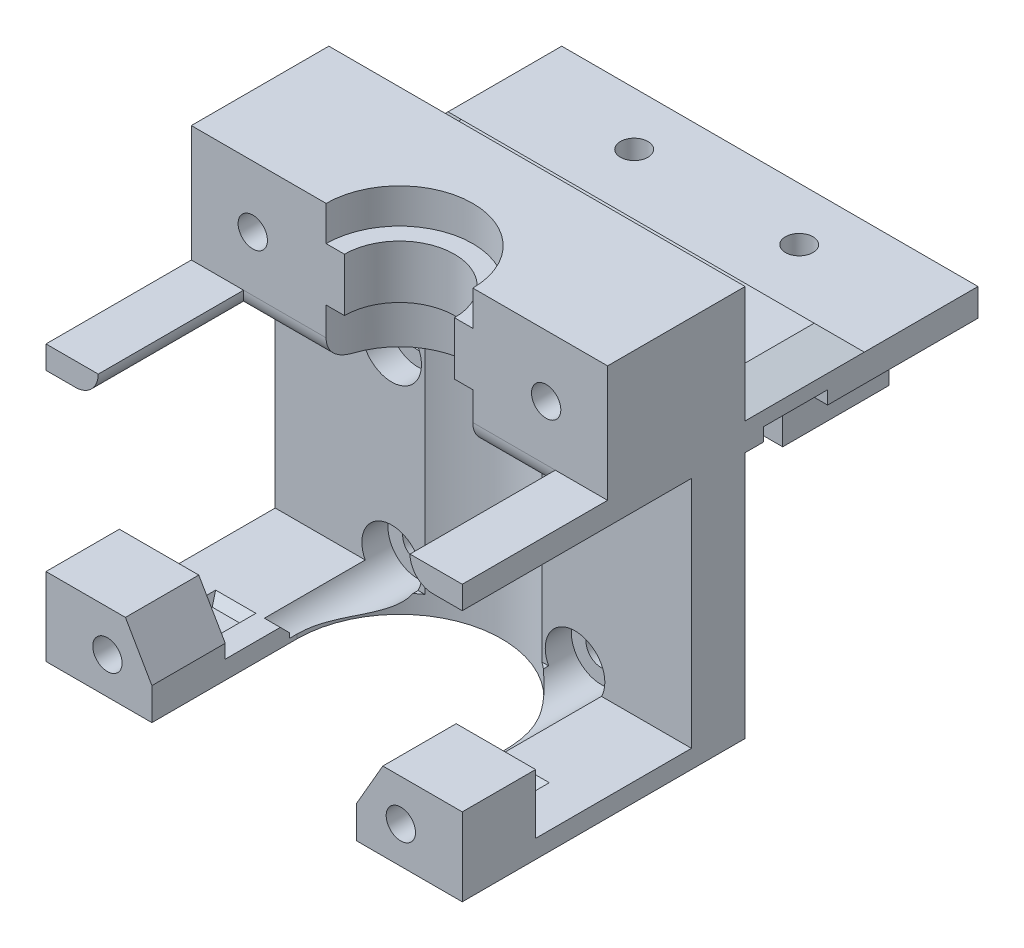
from build123d import *
from OCP.BRepFilletAPI import BRepFilletAPI_MakeChamfer

# Parameters (mm, degrees)
SKETCH1_W                = 45.4
SKETCH1_H                = 27
BOSS_EXTRUDE1_DEPTH      = 5.85
SKETCH3_W                = 45.4
SKETCH3_H                = 5.85
BOSS_EXTRUDE2_DEPTH      = 3
SKETCH4_W                = 45.4
SKETCH4_H                = 2.5
BOSS_EXTRUDE3_DEPTH      = 25
SKETCH6_W                = 45.4
SKETCH6_H                = 2
BOSS_EXTRUDE5_DEPTH      = 25
SKETCH7_R                = 1.65
CUT_EXTRUDE1_DEPTH       = 10
CUT_EXTRUDE2_DEPTH       = 10
CUT_EXTRUDE2_DEPTH_BACK  = 2.85
SKETCH8_R                = 3.25
SKETCH37_W               = 45.4
SKETCH37_H               = 15
BOSS_EXTRUDE16_DEPTH     = 12.7
CUT_EXTRUDE3_DEPTH       = 69.332806909
CUT_EXTRUDE4_DEPTH       = 62.393261076
SKETCH18_W               = 45.4
SKETCH18_H               = 3
BOSS_EXTRUDE8_DEPTH      = 25.4
SKETCH19_W               = 26
SKETCH19_H               = 11.6
BOSS_EXTRUDE9_DEPTH      = 11.2
SKETCH20_R               = 1.5
CUT_EXTRUDE9_DEPTH       = 62.1268558
SKETCH21_W               = 45.4
SKETCH21_H               = 10
BOSS_EXTRUDE10_DEPTH     = 2
SKETCH22_W               = 7
SKETCH22_H               = 1.45
CUT_EXTRUDE10_DEPTH      = 70.542594861
SKETCH23_W               = 3
SKETCH23_H               = 7
CUT_EXTRUDE11_DEPTH      = 10
SKETCH24_W               = 19.4
SKETCH24_H               = 7
BOSS_EXTRUDE11_DEPTH     = 1.45
CHAMFER2_SIZE            = 2
CHAMFER2_SIZE2           = 3.464101615
CHAMFER3_SIZE            = 3
CHAMFER4_SIZE            = 2.1
SKETCH35_W               = 7.6
SKETCH35_H               = 2
CUT_EXTRUDE14_DEPTH      = 11.6
FILLET8_R                = 10
SKETCH36_R               = 11.15
CUT_EXTRUDE15_DEPTH      = 25.5
SKETCH39_R               = 8
SKETCH39_R_2             = 6
BOSS_EXTRUDE17_DEPTH     = 5.8
SKETCH40_W               = 45.4
SKETCH40_H               = 10
CUT_EXTRUDE16_DEPTH      = 63.553037544
SKETCH41_R               = 1.6
CUT_EXTRUDE17_DEPTH      = 75.273885047
SKETCH42_R               = 3.4
CUT_EXTRUDE18_DEPTH      = 12
SKETCH43_W               = 11.55
SKETCH43_H               = 6.5
BOSS_EXTRUDE18_DEPTH     = 8
SKETCH44_R               = 1.6
CUT_EXTRUDE19_DEPTH      = 10
CUT_EXTRUDE20_DEPTH      = 5
CUT_EXTRUDE20_DEPTH_BACK = 4
CUT_EXTRUDE21_DEPTH      = 79.819493147
SKETCH47_W               = 9
SKETCH47_H               = 15.85
CUT_EXTRUDE22_DEPTH      = 4
FILLET11_R               = 2.5
CHAMFER7_SIZE            = 1


# Some blends are built 0.0001 mm under size
with BuildPart() as part:
    # Sketch1 → Boss-Extrude1 (new body)
    with BuildSketch(Plane.XY):
        with Locations((22.7, 13.5)):
            Rectangle(SKETCH1_W, SKETCH1_H)
    extrude(amount=BOSS_EXTRUDE1_DEPTH)

    # Sketch3 → Boss-Extrude2 (add)
    with BuildSketch(Plane(origin=(0, 27, 0), x_dir=(1, 0, 0), z_dir=(0, 1, 0))):
        with Locations((22.7, -2.925)):
            Rectangle(SKETCH3_W, SKETCH3_H)
    extrude(amount=BOSS_EXTRUDE2_DEPTH)

    # Sketch4 → Boss-Extrude3 (add)
    with BuildSketch(Plane.XY.offset(5.85)):
        with Locations((22.7, 28.75)):
            Rectangle(SKETCH4_W, SKETCH4_H)
    extrude(amount=BOSS_EXTRUDE3_DEPTH)

    # Sketch6 → Boss-Extrude5 (add)
    with BuildSketch(Plane.XY.offset(5.85)):
        with Locations((22.7, 1)):
            Rectangle(SKETCH6_W, SKETCH6_H)
    extrude(amount=BOSS_EXTRUDE5_DEPTH)

    # Sketch7 → Cut-Extrude1 (cut)
    with BuildSketch(Plane.XY.offset(5.85)):
        with Locations((12.7, 23.5)):
            Circle(SKETCH7_R)
        with Locations((32.7, 23.5)):
            Circle(SKETCH7_R)
        with Locations(Location((32.7, 3.5, 0), (0, 0, 294.619977329))):
            Circle(SKETCH7_R)
        with Locations(Location((12.7, 3.5, 0), (0, 0, 294.619977329))):
            Circle(SKETCH7_R)
    extrude(amount=-CUT_EXTRUDE1_DEPTH, mode=Mode.SUBTRACT)

    # Sketch8 → Cut-Extrude2 (cut, two sides: drawn at the far end of the back side and taken through both)
    with BuildSketch(Plane.XY.offset(5.85).offset(-CUT_EXTRUDE2_DEPTH_BACK)):
        with Locations(Location((12.7, 23.5, 0), (0, 0, 180))):
            Circle(SKETCH8_R)
        with Locations(Location((32.7, 23.5, 0), (0, 0, 180))):
            Circle(SKETCH8_R)
        with Locations(Location((32.7, 3.5, 0), (0, 0, 180))):
            Circle(SKETCH8_R)
        with Locations(Location((12.7, 3.5, 0), (0, 0, 180))):
            Circle(SKETCH8_R)
    extrude(amount=CUT_EXTRUDE2_DEPTH + CUT_EXTRUDE2_DEPTH_BACK, mode=Mode.SUBTRACT)

    # Sketch37 → Boss-Extrude16 (add)
    with BuildSketch(Plane(origin=(0, 30, 0), x_dir=(1, 0, 0), z_dir=(0, 1, 0))):
        with Locations((22.7, -7.5)):
            Rectangle(SKETCH37_W, SKETCH37_H)
    extrude(amount=BOSS_EXTRUDE16_DEPTH)

    # Sketch9 → Cut-Extrude3 (cut, through all)
    with BuildSketch(Plane(origin=(0, 2, 0), x_dir=(1, 0, 0), z_dir=(0, 1, 0))):
        with BuildLine():
            Line((11.55, -15), (11.55, -30.85))
            Line((11.55, -30.85), (33.85, -30.85))
            Line((33.85, -30.85), (33.85, -15))
            ThreePointArc((33.85, -15), (22.7, -3.85), (11.55, -15))
        make_face()
    extrude(amount=-CUT_EXTRUDE3_DEPTH, mode=Mode.SUBTRACT)

    # Sketch10 → Cut-Extrude4 (cut, through all)
    with BuildSketch(Plane.XZ.offset(-27.5)):
        with BuildLine():
            Line((14.7, 15), (14.7, 30.85))
            Line((14.7, 30.85), (30.7, 30.85))
            Line((30.7, 30.85), (30.7, 15))
            ThreePointArc((30.7, 15), (22.7, 7), (14.7, 15))
        make_face()
    extrude(amount=-CUT_EXTRUDE4_DEPTH, mode=Mode.SUBTRACT)

    # Sketch18 → Boss-Extrude8 (add)
    with BuildSketch(Plane(origin=(0, 0, 0), x_dir=(-1, 0, 0), z_dir=(0, 0, -1))):
        with Locations((-22.7, 28.5)):
            Rectangle(SKETCH18_W, SKETCH18_H)
    extrude(amount=BOSS_EXTRUDE8_DEPTH)

    # Sketch19 → Boss-Extrude9 (add)
    with BuildSketch(Plane.XZ.offset(-27)):
        with Locations((22.7, -19.6)):
            Rectangle(SKETCH19_W, SKETCH19_H)
    extrude(amount=BOSS_EXTRUDE9_DEPTH)

    # Sketch20 → Cut-Extrude9 (cut, through all)
    with BuildSketch(Plane.XZ.offset(-15.8)):
        with Locations(Location((31.697973531, -19.6, 0), (0, 0, 270))):
            Circle(SKETCH20_R)
        with Locations(Location((13.699854881, -19.6, 0), (0, 0, 270))):
            Circle(SKETCH20_R)
    extrude(amount=-CUT_EXTRUDE9_DEPTH, mode=Mode.SUBTRACT)

    # Sketch21 → Boss-Extrude10 (add)
    with BuildSketch(Plane(origin=(0, 30, 0), x_dir=(1, 0, 0), z_dir=(0, 1, 0))):
        with Locations((22.7, 5)):
            Rectangle(SKETCH21_W, SKETCH21_H)
    extrude(amount=BOSS_EXTRUDE10_DEPTH)

    # Sketch22 → Cut-Extrude10 (cut, through all)
    with BuildSketch(Plane(origin=(45.4, 0, 0), x_dir=(0, 0, -1), z_dir=(1, 0, 0))):
        with Locations((5.5, 27.725)):
            Rectangle(SKETCH22_W, SKETCH22_H)
    extrude(amount=-CUT_EXTRUDE10_DEPTH, mode=Mode.SUBTRACT)

    # Sketch23 → Cut-Extrude11 (cut)
    with BuildSketch(Plane.XZ.offset(-28.45)):
        with Locations((11.5, -5.5)):
            Rectangle(SKETCH23_W, SKETCH23_H)
        with Locations((33.9, -5.5)):
            Rectangle(SKETCH23_W, SKETCH23_H)
    extrude(amount=-CUT_EXTRUDE11_DEPTH, mode=Mode.SUBTRACT)

    # Sketch24 → Boss-Extrude11 (add)
    with BuildSketch(Plane.XZ.offset(-28.45)):
        with Locations((22.7, -5.5)):
            Rectangle(SKETCH24_W, SKETCH24_H)
    extrude(amount=BOSS_EXTRUDE11_DEPTH)

    # Chamfer1
    # the kernel refuses this chamfer: 8 mm, written as the material it takes off along each edge
    with BuildSketch(Plane(origin=(32.4, 32, -2), x_dir=(-1, 0, 0), z_dir=(0, 0, -1)), Plane(origin=(13, 32, -9), x_dir=(1, 0, 0), z_dir=(0, 0, 1))) as chamfer1_piece_1:
        with BuildLine():
            Line((8.22627417, 0.22627417), (-0.22627417, -8.22627417))
            Line((-0.22627417, -8.22627417), (-0.38627417, -8.22627417))
            ThreePointArc((-0.38627417, -8.22627417), (-0.16, -4.113137085), (-0.16, 0))
            Line((-0.16, 0), (0, 0.16))
            ThreePointArc((0, 0.16), (4.113137085, 0.16), (8.22627417, 0.38627417))
            Line((8.22627417, 0.38627417), (8.22627417, 0.22627417))
        make_face()
    extrude(amount=7, mode=Mode.SUBTRACT)

    # Chamfer2: one chamfer whose edges measure the first distance from different faces: ONE call of the kernel's chamfer builder (chamfer() names one face for all edges)
    chamfer2_edges_1 = [part.edges().sort_by_distance(p)[0] for p in [
        (45.4, 32, -5),
    ]]
    chamfer2_side_1 = [part.faces().sort_by_distance(p)[0] for p in [
        (45.4, 24.646782836, 5.304308741),
    ]]
    chamfer2_edges_2 = [part.edges().sort_by_distance(p)[0] for p in [
        (0, 32, -5),
    ]]
    chamfer2_side_2 = [part.faces().sort_by_distance(p)[0] for p in [
        (0, 24.646782836, 5.304308741),
    ]]
    chamfer2 = BRepFilletAPI_MakeChamfer(part.part.solid().wrapped)
    for e in chamfer2_edges_1:
        chamfer2.Add(CHAMFER2_SIZE, CHAMFER2_SIZE2, e.wrapped, chamfer2_side_1[0].wrapped)  # the first distance lies on this face
    for e in chamfer2_edges_2:
        chamfer2.Add(CHAMFER2_SIZE, CHAMFER2_SIZE2, e.wrapped, chamfer2_side_2[0].wrapped)  # the first distance lies on this face
    add(Compound.cast(chamfer2.Shape()), mode=Mode.REPLACE)

    # Chamfer3
    # the kernel refuses this chamfer: 3 mm, written as the material it adds along each edge
    with BuildSketch(Plane(origin=(0, 30, -10), x_dir=(0, 1, 0), z_dir=(1, 0, 0))) as chamfer3_piece_1_section:
        Polygon((CHAMFER3_SIZE, 0), (0, -CHAMFER3_SIZE), (0, 0), align=None)
    chamfer3_piece_1 = extrude(amount=45.4, mode=Mode.PRIVATE)
    chamfer3_piece_1 = split(chamfer3_piece_1, bisect_by=Plane(origin=(0, 30, -10), z_dir=(0.49999999999999795, -0.8660254037844398, 0)), keep=Keep.TOP, mode=Mode.PRIVATE)
    chamfer3_piece_1 = split(chamfer3_piece_1, bisect_by=Plane(origin=(0, 32, -10), z_dir=(0, -1, 0)), keep=Keep.TOP, mode=Mode.PRIVATE)
    chamfer3_piece_1 = split(chamfer3_piece_1, bisect_by=Plane(origin=(11.35, 49.658776666, -10), z_dir=(-0.4999999999999982, -0.8660254037844397, 0)), keep=Keep.TOP, mode=Mode.PRIVATE)
    add(chamfer3_piece_1)

    # Chamfer4
    chamfer4_edges = [part.edges().sort_by_distance(p)[0] for p in [
        (35.7, 27, -19.6),
        (9.7, 27, -19.6),
    ]]
    chamfer(chamfer4_edges, length=CHAMFER4_SIZE)

    # Sketch35 → Cut-Extrude14 (cut)
    with BuildSketch(Plane(origin=(0, 0, -25.4), x_dir=(-1, 0, 0), z_dir=(0, 0, -1))):
        with Locations((-3.8, 28)):
            Rectangle(SKETCH35_W, SKETCH35_H)
    extrude(amount=-CUT_EXTRUDE14_DEPTH, mode=Mode.SUBTRACT)

    # Fillet8
    # the kernel refuses this fillet: 10 mm, written as the material it adds along each edge
    with BuildSketch(Plane(origin=(7.6, 29, -25.4), x_dir=(-1, 0, 0), z_dir=(0, 0, 1))) as fillet8_piece_1:
        with BuildLine():
            CenterArc((6, 10), FILLET8_R, 233.130102354, 36.869897646)
            Line((0, 2), (0, 0))
            Line((0, 0), (6, 0))
        make_face()
    extrude(amount=11.6)

    # Sketch36 → Cut-Extrude15 (cut)
    with BuildSketch(Plane.XZ.offset(-27.5)):
        with Locations((22.7, 15)):
            Circle(SKETCH36_R)
    extrude(amount=CUT_EXTRUDE15_DEPTH, mode=Mode.SUBTRACT)

    # Sketch39 → Boss-Extrude17 (add)
    with BuildSketch(Plane(origin=(0, 33.1, 0), x_dir=(1, 0, 0), z_dir=(0, 1, 0))):
        with Locations((22.7, -15)):
            Circle(SKETCH39_R)
        with Locations(Location((22.7, -15, 0), (0, 0, 270))):
            Circle(SKETCH39_R_2, mode=Mode.SUBTRACT)
    extrude(amount=BOSS_EXTRUDE17_DEPTH)

    # Sketch40 → Cut-Extrude16 (cut, through all)
    with BuildSketch(Plane(origin=(0, 30, 0), x_dir=(1, 0, 0), z_dir=(0, 1, 0))):
        with Locations((22.7, -20)):
            Rectangle(SKETCH40_W, SKETCH40_H)
    extrude(amount=CUT_EXTRUDE16_DEPTH, mode=Mode.SUBTRACT)

    # Sketch41 → Cut-Extrude17 (cut, through all)
    with BuildSketch(Plane.XY.offset(15)):
        with Locations((6.7, 36)):
            Circle(SKETCH41_R)
        with Locations((38.7, 36)):
            Circle(SKETCH41_R)
    extrude(amount=-CUT_EXTRUDE17_DEPTH, mode=Mode.SUBTRACT)

    # Sketch42 → Cut-Extrude18 (cut)
    with BuildSketch(Plane(origin=(0, 0, 0), x_dir=(-1, 0, 0), z_dir=(0, 0, -1))):
        with Locations((-38.7, 36)):
            Circle(SKETCH42_R)
        with Locations((-6.7, 36)):
            Circle(SKETCH42_R)
    extrude(amount=-CUT_EXTRUDE18_DEPTH, mode=Mode.SUBTRACT)

    # Sketch43 → Boss-Extrude18 (add)
    with BuildSketch(Plane.XY.offset(30.85)):
        with Locations((5.775, 5.25)):
            Rectangle(SKETCH43_W, SKETCH43_H)
        with Locations((39.625, 5.25)):
            Rectangle(SKETCH43_W, SKETCH43_H)
    extrude(amount=-BOSS_EXTRUDE18_DEPTH)

    # Sketch44 → Cut-Extrude19 (cut)
    with BuildSketch(Plane.XY.offset(30.85)):
        with Locations((6.7, 4)):
            Circle(SKETCH44_R)
        with Locations((38.7, 4)):
            Circle(SKETCH44_R)
    extrude(amount=-CUT_EXTRUDE19_DEPTH, mode=Mode.SUBTRACT)

    # Sketch45 → Cut-Extrude20 (cut, two sides: drawn at the far end of the back side and taken through both)
    with BuildSketch(Plane(origin=(0, 0, 22.85), x_dir=(-1, 0, 0), z_dir=(0, 0, -1)).offset(-CUT_EXTRUDE20_DEPTH_BACK)):
        Polygon((-40.374315781, 6.9), (-42.048631561, 4), (-40.374315781, 1.1), (-37.025684219, 1.1), (-35.351368439, 4), (-37.025684219, 6.9), align=None)
        Polygon((-8.374315781, 6.9), (-10.048631561, 4), (-8.374315781, 1.1), (-5.025684219, 1.1), (-3.351368439, 4), (-5.025684219, 6.9), align=None)
    extrude(amount=CUT_EXTRUDE20_DEPTH + CUT_EXTRUDE20_DEPTH_BACK, mode=Mode.SUBTRACT)

    # Sketch46 → Cut-Extrude21 (cut, through all)
    with BuildSketch(Plane(origin=(0, 0, 22.85), x_dir=(-1, 0, 0), z_dir=(0, 0, -1))):
        Polygon((-36.736751346, 8.5), (-33.85, 3.5), (-33.85, 8.5), align=None)
        Polygon((-11.55, 8.5), (-8.663248654, 8.5), (-11.55, 3.5), align=None)
    extrude(amount=-CUT_EXTRUDE21_DEPTH, mode=Mode.SUBTRACT)

    # Sketch47 → Cut-Extrude22 (cut)
    with BuildSketch(Plane.XZ.offset(-27.5)):
        with Locations((10.2, 22.925)):
            Rectangle(SKETCH47_W, SKETCH47_H)
        with Locations((35.2, 22.925)):
            Rectangle(SKETCH47_W, SKETCH47_H)
    extrude(amount=-CUT_EXTRUDE22_DEPTH, mode=Mode.SUBTRACT)

    # Fillet11
    fillet11_edges = [part.edges().sort_by_distance(p)[0] for p in [
        (10.2, 27.5, 15),
        (35.2, 27.5, 15),
        (39.7, 27.5, 22.925),
        (5.7, 27.5, 22.925),
    ]]
    fillet(fillet11_edges, radius=FILLET11_R - 0.0001)  # a hair under: the kernel refuses the full size

    # Chamfer7
    # the kernel refuses this chamfer: 1 mm, written as the material it takes off along each edge
    with BuildSketch(Plane(origin=(14.121682988, 2, 15.85), x_dir=(0, 0, 1), z_dir=(-1, 0, 0))) as chamfer7_piece_1_section:
        Polygon((CHAMFER7_SIZE, 0), (0, -CHAMFER7_SIZE), (0, 0), align=None)
    chamfer7_piece_1 = extrude(amount=6.876506625, mode=Mode.PRIVATE)
    chamfer7_piece_1 = chamfer7_piece_1 & Plane(origin=(12.7, 3.5, 15.85), x_dir=(-1, 0, 0), z_dir=(0, 0, 1)) * Cylinder(3.25, 18, mode=Mode.PRIVATE)
    add(chamfer7_piece_1, mode=Mode.SUBTRACT)
    with BuildSketch(Plane(origin=(38.154823637, 2, 15.85), x_dir=(0, 0, 1), z_dir=(-1, 0, 0))) as chamfer7_piece_2_section:
        Polygon((CHAMFER7_SIZE, 0), (0, -CHAMFER7_SIZE), (0, 0), align=None)
    chamfer7_piece_2 = extrude(amount=6.876506625, mode=Mode.PRIVATE)
    chamfer7_piece_2 = chamfer7_piece_2 & Plane(origin=(32.7, 3.5, 15.85), x_dir=(-1, 0, 0), z_dir=(0, 0, 1)) * Cylinder(3.25, 18, mode=Mode.PRIVATE)
    add(chamfer7_piece_2, mode=Mode.SUBTRACT)
    with BuildSketch(Plane(origin=(33.934385989, 2, 17.85), x_dir=(0, 0, -1), z_dir=(1, 0, 0))) as chamfer7_piece_3_section:
        Polygon((CHAMFER7_SIZE, 0), (0, -CHAMFER7_SIZE), (0, 0), align=None)
    chamfer7_piece_3 = extrude(amount=9.531228022, mode=Mode.PRIVATE)
    chamfer7_piece_3 = split(chamfer7_piece_3, bisect_by=Plane(origin=(35.86314823, 3.113571399, 17.85), z_dir=(0.8660254037844388, 0.4999999999999997, 0)), keep=Keep.TOP, mode=Mode.PRIVATE)
    chamfer7_piece_3 = split(chamfer7_piece_3, bisect_by=Plane(origin=(39.154044764, -1.013571399, 17.85), z_dir=(-0.8660254037844384, 0.5000000000000007, 0)), keep=Keep.TOP, mode=Mode.PRIVATE)
    chamfer7_piece_3 = split(chamfer7_piece_3, bisect_by=Plane(origin=(33.934385989, 1.1, 17.85), z_dir=(0, 1, 0)), keep=Keep.TOP, mode=Mode.PRIVATE)
    add(chamfer7_piece_3, mode=Mode.SUBTRACT)
    with BuildSketch(Plane(origin=(1.934385989, 2, 17.85), x_dir=(0, 0, -1), z_dir=(1, 0, 0))) as chamfer7_piece_4_section:
        Polygon((CHAMFER7_SIZE, 0), (0, -CHAMFER7_SIZE), (0, 0), align=None)
    chamfer7_piece_4 = extrude(amount=9.531228022, mode=Mode.PRIVATE)
    chamfer7_piece_4 = split(chamfer7_piece_4, bisect_by=Plane(origin=(3.86314823, 3.113571399, 17.85), z_dir=(0.8660254037844382, 0.5000000000000009, 0)), keep=Keep.TOP, mode=Mode.PRIVATE)
    chamfer7_piece_4 = split(chamfer7_piece_4, bisect_by=Plane(origin=(1.934385989, 1.1, 17.85), z_dir=(0, 1, 0)), keep=Keep.TOP, mode=Mode.PRIVATE)
    chamfer7_piece_4 = split(chamfer7_piece_4, bisect_by=Plane(origin=(7.154044764, -1.013571399, 17.85), z_dir=(-0.8660254037844392, 0.49999999999999906, 0)), keep=Keep.TOP, mode=Mode.PRIVATE)
    add(chamfer7_piece_4, mode=Mode.SUBTRACT)


solid = part.part
